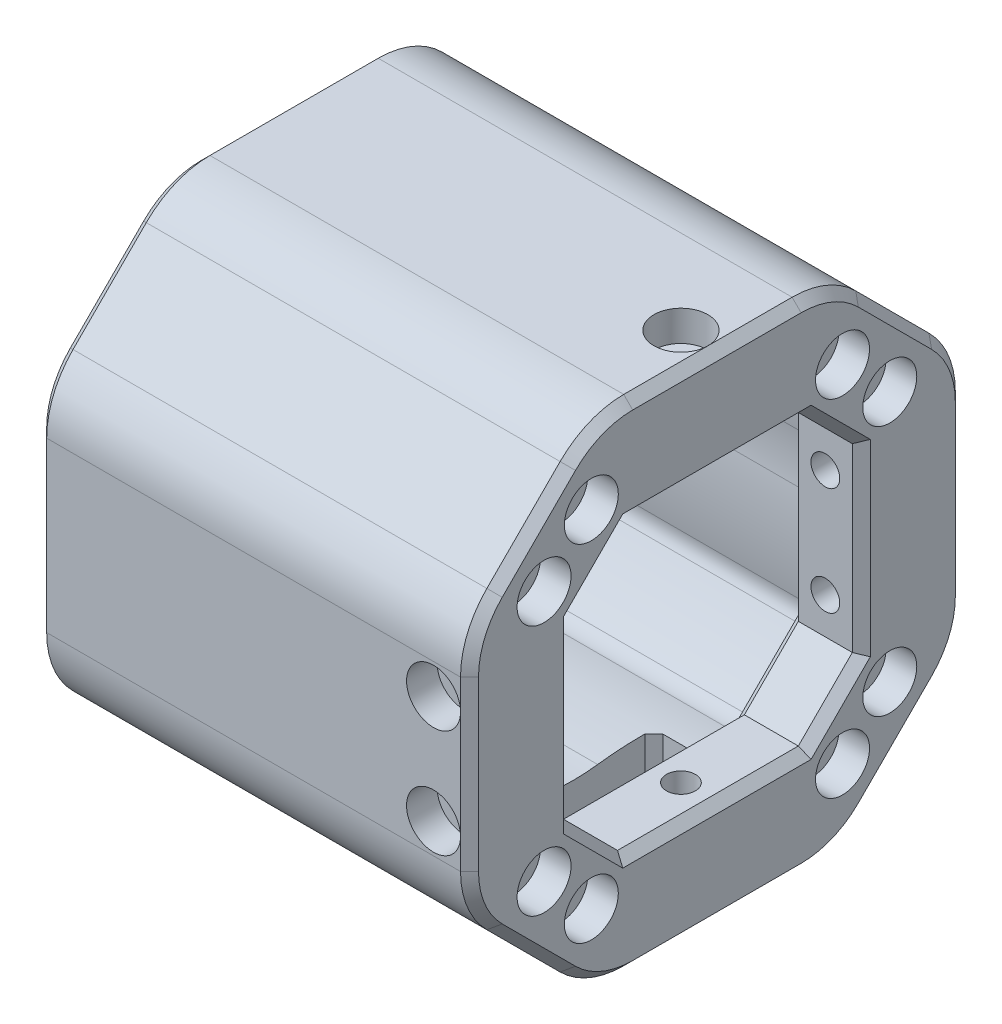
from build123d import *

# Parameters (mm, degrees)
SKETCH_1_W                   = 55
SKETCH_1_H                   = 55
SKETCH_1_W_2                 = 32.1
SKETCH_1_H_2                 = 32.1
EXTRUDE_1_DEPTH              = 8
CHAMFER_1_SIZE               = 14
CHAMFER_2_SIZE               = 6
HOLE_WIZARD_M3_1_D           = 3.2
HOLE_WIZARD_M3_1_CBORE_D     = 6
HOLE_WIZARD_M3_1_CBORE_DEPTH = 3.4
HOLE_WIZARD_M3_2_D           = 3.2
HOLE_WIZARD_M3_2_DEPTH       = 11.45
HOLE_WIZARD_M3_2_CBORE_D     = 6
HOLE_WIZARD_M3_2_CBORE_DEPTH = 3.4
HOLE_WIZARD_M3_3_D           = 3.2
HOLE_WIZARD_M3_3_DEPTH       = 11.45
HOLE_WIZARD_M3_3_CBORE_D     = 6
HOLE_WIZARD_M3_3_CBORE_DEPTH = 3.4
HOLE_WIZARD_M3_4_D           = 3.2
HOLE_WIZARD_M3_4_CBORE_D     = 6
HOLE_WIZARD_M3_4_CBORE_DEPTH = 3.4
HOLE_WIZARD_M3_5_D           = 3.2
HOLE_WIZARD_M3_5_CBORE_D     = 6
HOLE_WIZARD_M3_5_CBORE_DEPTH = 3.4
FILLET_1_R                   = 10
CHAMFER_4_SIZE               = 1
EXTRUDE_2_DEPTH              = 40
CHAMFER_5_SIZE               = 1
SKETCH_18_W                  = 8
SKETCH_18_H                  = 18
CUT_EXTRUDE_1_DEPTH          = 40
CHAMFER_6_SIZE               = 1
CHAMFER_7_SIZE               = 1


# Some blends are built 0.0001 mm under size
with BuildPart() as part:
    # 草图1 → 凸台-拉伸1 (new body)
    with BuildSketch(Plane(origin=(0, 0, 0), x_dir=(0, 0, -1), z_dir=(1, 0, 0))):
        Rectangle(SKETCH_1_W, SKETCH_1_H)
        Rectangle(SKETCH_1_W_2, SKETCH_1_H_2, mode=Mode.SUBTRACT)
    extrude(amount=EXTRUDE_1_DEPTH)

    # 倒角1
    chamfer_1_edges = [part.edges().sort_by_distance(p)[0] for p in [
        (4, -27.5, -27.5),
        (4, -27.5, 27.5),
        (4, 27.5, 27.5),
        (4, 27.5, -27.5),
    ]]
    chamfer(chamfer_1_edges, length=CHAMFER_1_SIZE)

    # 倒角2
    chamfer_2_edges = [part.edges().sort_by_distance(p)[0] for p in [
        (4, -16.05, -16.05),
        (4, 16.05, -16.05),
        (4, 16.05, 16.05),
        (4, -16.05, 16.05),
    ]]
    chamfer(chamfer_2_edges, length=CHAMFER_2_SIZE)

    # M3 六角圆柱头螺钉的柱形沉头孔1 (through all)
    with Locations(Plane(origin=(8, 0, 0), x_dir=(0, 0, -1), z_dir=(1, 0, 0))):
        with Locations((-13.959899742, 19.214153616), (13.959899742, 19.214153616), (19.214153616, -13.959899742), (-13.959899742, -19.214153616), (-19.214153616, 13.959899742), (19.214153616, 13.959899742), (13.959899742, -19.214153616), (-19.214153616, -13.959899742)):
            CounterBoreHole(HOLE_WIZARD_M3_1_D / 2, HOLE_WIZARD_M3_1_CBORE_D / 2, HOLE_WIZARD_M3_1_CBORE_DEPTH)

    # M3 六角圆柱头螺钉的柱形沉头孔2
    with Locations(Plane(origin=(0, 27.5, 0), x_dir=(1, 0, 0), z_dir=(0, 1, 0))):
        with Locations((4, 0)):
            CounterBoreHole(HOLE_WIZARD_M3_2_D / 2, HOLE_WIZARD_M3_2_CBORE_D / 2, HOLE_WIZARD_M3_2_CBORE_DEPTH, depth=HOLE_WIZARD_M3_2_DEPTH)

    # M3 六角圆柱头螺钉的柱形沉头孔3
    with Locations(Plane(origin=(0, 0, -27.5), x_dir=(-1, 0, 0), z_dir=(0, 0, -1))):
        with Locations((-4, 6), (-4, -6)):
            CounterBoreHole(HOLE_WIZARD_M3_3_D / 2, HOLE_WIZARD_M3_3_CBORE_D / 2, HOLE_WIZARD_M3_3_CBORE_DEPTH, depth=HOLE_WIZARD_M3_3_DEPTH)

    # M3 六角圆柱头螺钉的柱形沉头孔4 (through all)
    with Locations(Plane.XY.offset(27.5)):
        with Locations((4, -6), (4, 6)):
            CounterBoreHole(HOLE_WIZARD_M3_4_D / 2, HOLE_WIZARD_M3_4_CBORE_D / 2, HOLE_WIZARD_M3_4_CBORE_DEPTH)

    # M3 六角圆柱头螺钉的柱形沉头孔5 (through all)
    with Locations(Plane.XZ.offset(27.5)):
        with Locations((4, 0)):
            CounterBoreHole(HOLE_WIZARD_M3_5_D / 2, HOLE_WIZARD_M3_5_CBORE_D / 2, HOLE_WIZARD_M3_5_CBORE_DEPTH)

    # 圆角1
    fillet_1_edges = [part.edges().sort_by_distance(p)[0] for p in [
        (4, -27.5, -13.5),
        (4, -27.5, 13.5),
        (4, 13.5, 27.5),
        (4, -13.5, 27.5),
        (4, 13.5, -27.5),
        (4, -13.5, -27.5),
        (4, 27.5, 13.5),
        (4, 27.5, -13.5),
    ]]
    fillet(fillet_1_edges, radius=FILLET_1_R)

    # 倒角4
    chamfer_4_edges = [part.edges().sort_by_distance(p)[0] for p in [
        (8, 27.5, 0),
        (8, 0, 27.5),
        (8, -20.5, 20.5),
        (8, -27.5, 0),
        (8, -20.5, -20.5),
        (8, 0, -27.5),
        (8, 20.5, -20.5),
        (8, 20.5, 20.5),
        (8, -13.1846987, 26.738795325),
        (8, -26.738795325, 13.1846987),
        (8, -26.738795325, -13.1846987),
        (8, -13.1846987, -26.738795325),
        (8, 13.1846987, -26.738795325),
        (8, 26.738795325, -13.1846987),
        (8, 13.1846987, 26.738795325),
        (8, 26.738795325, 13.1846987),
        (8, 0, 16.05),
        (8, -16.05, 0),
        (8, 0, -16.05),
        (8, 16.05, 0),
        (8, -13.05, 13.05),
        (8, -13.05, -13.05),
        (8, 13.05, -13.05),
        (8, 13.05, 13.05),
    ]]
    chamfer(chamfer_4_edges, length=CHAMFER_4_SIZE - 0.0001)  # a hair under: the kernel refuses the full size

    # 草图16 → 凸台-拉伸2 (add)
    with BuildSketch(Plane.ZY):
        with BuildLine():
            Line((27.5, -9.357864376), (27.5, 9.357864376))
            ThreePointArc((27.5, 9.357864376), (26.738795325, 13.1846987), (24.571067812, 16.428932188))
            Line((24.571067812, 16.428932188), (16.428932188, 24.571067812))
            ThreePointArc((16.428932188, 24.571067812), (13.1846987, 26.738795325), (9.357864376, 27.5))
            Line((9.357864376, 27.5), (-9.357864376, 27.5))
            ThreePointArc((-9.357864376, 27.5), (-13.1846987, 26.738795325), (-16.428932188, 24.571067812))
            Line((-16.428932188, 24.571067812), (-24.571067812, 16.428932188))
            ThreePointArc((-24.571067812, 16.428932188), (-26.738795325, 13.1846987), (-27.5, 9.357864376))
            Line((-27.5, 9.357864376), (-27.5, -9.357864376))
            ThreePointArc((-27.5, -9.357864376), (-26.738795325, -13.1846987), (-24.571067812, -16.428932188))
            Line((-24.571067812, -16.428932188), (-16.428932188, -24.571067812))
            ThreePointArc((-16.428932188, -24.571067812), (-13.1846987, -26.738795325), (-9.357864376, -27.5))
            Line((-9.357864376, -27.5), (9.357864376, -27.5))
            ThreePointArc((9.357864376, -27.5), (13.1846987, -26.738795325), (16.428932188, -24.571067812))
            Line((16.428932188, -24.571067812), (24.571067812, -16.428932188))
            ThreePointArc((24.571067812, -16.428932188), (26.738795325, -13.1846987), (27.5, -9.357864376))
        make_face()
        with BuildLine():
            ThreePointArc((2.7470939, -21.676622779), (0, -21.85), (-2.7470939, -21.676622779))
            ThreePointArc((-2.7470939, -21.676622779), (-8.167703104, -21.362068054), (-13.580827481, -21.786371379))
            ThreePointArc((-13.580827481, -21.786371379), (-14.580451707, -21.73901307), (-15.488141398, -21.317597802))
            ThreePointArc((-15.488141398, -21.317597802), (-18.632263684, -18.632263684), (-21.317597802, -15.488141398))
            ThreePointArc((-21.317597802, -15.488141398), (-21.73901307, -14.580451707), (-21.786371379, -13.580827481))
            ThreePointArc((-21.786371379, -13.580827481), (-21.362068054, -8.167703104), (-21.676622779, -2.7470939))
            ThreePointArc((-21.676622779, -2.7470939), (-21.85, 0), (-21.676622779, 2.7470939))
            ThreePointArc((-21.676622779, 2.7470939), (-21.362068054, 8.167703104), (-21.786371379, 13.580827481))
            ThreePointArc((-21.786371379, 13.580827481), (-21.73901307, 14.580451707), (-21.317597802, 15.488141398))
            ThreePointArc((-21.317597802, 15.488141398), (-18.632263684, 18.632263684), (-15.488141398, 21.317597802))
            ThreePointArc((-15.488141398, 21.317597802), (-14.580451707, 21.73901307), (-13.580827481, 21.786371379))
            ThreePointArc((-13.580827481, 21.786371379), (-8.167703104, 21.362068054), (-2.7470939, 21.676622779))
            ThreePointArc((-2.7470939, 21.676622779), (0, 21.85), (2.7470939, 21.676622779))
            ThreePointArc((2.7470939, 21.676622779), (8.167703104, 21.362068054), (13.580827481, 21.786371379))
            ThreePointArc((13.580827481, 21.786371379), (14.580451707, 21.73901307), (15.488141398, 21.317597802))
            ThreePointArc((15.488141398, 21.317597802), (18.632263684, 18.632263684), (21.317597802, 15.488141398))
            ThreePointArc((21.317597802, 15.488141398), (21.73901307, 14.580451707), (21.786371379, 13.580827481))
            ThreePointArc((21.786371379, 13.580827481), (21.362068054, 8.167703104), (21.676622779, 2.7470939))
            ThreePointArc((21.676622779, 2.7470939), (21.85, 0), (21.676622779, -2.7470939))
            ThreePointArc((21.676622779, -2.7470939), (21.362068054, -8.167703104), (21.786371379, -13.580827481))
            ThreePointArc((21.786371379, -13.580827481), (21.73901307, -14.580451707), (21.317597802, -15.488141398))
            ThreePointArc((21.317597802, -15.488141398), (18.632263684, -18.632263684), (15.488141398, -21.317597802))
            ThreePointArc((15.488141398, -21.317597802), (14.580451707, -21.73901307), (13.580827481, -21.786371379))
            ThreePointArc((13.580827481, -21.786371379), (8.167703104, -21.362068054), (2.7470939, -21.676622779))
        make_face(mode=Mode.SUBTRACT)
    extrude(amount=EXTRUDE_2_DEPTH)

    # 倒角5
    chamfer_5_edges = [part.edges().sort_by_distance(p)[0] for p in [
        (-40, -21.73901307, -14.580451707),
        (-40, -18.632263684, -18.632263684),
        (-40, -8.167703104, -21.362068054),
        (-40, 0, -21.85),
        (-40, 14.580451707, -21.73901307),
        (-40, 21.362068054, -8.167703104),
        (-40, 21.85, 0),
        (-40, 21.73901307, 14.580451707),
        (-40, 18.632263684, 18.632263684),
        (-40, 8.167703104, 21.362068054),
        (-40, -14.580451707, 21.73901307),
        (-40, -21.362068054, 8.167703104),
        (-40, -21.85, 0),
        (-40, -21.362068054, -8.167703104),
        (-40, -14.580451707, -21.73901307),
        (-40, 8.167703104, -21.362068054),
        (-40, 18.632263684, -18.632263684),
        (-40, 21.73901307, -14.580451707),
        (-40, 21.362068054, 8.167703104),
        (-40, 14.580451707, 21.73901307),
        (-40, 0, 21.85),
        (-40, -8.167703104, 21.362068054),
        (-40, -18.632263684, 18.632263684),
        (-40, -21.73901307, 14.580451707),
        (-40, 0, 27.5),
        (-40, 13.1846987, 26.738795325),
        (-40, 20.5, 20.5),
        (-40, 26.738795325, 13.1846987),
        (-40, 27.5, 0),
        (-40, 26.738795325, -13.1846987),
        (-40, 20.5, -20.5),
        (-40, 13.1846987, -26.738795325),
        (-40, 0, -27.5),
        (-40, -13.1846987, -26.738795325),
        (-40, -20.5, -20.5),
        (-40, -26.738795325, -13.1846987),
        (-40, -27.5, 0),
        (-40, -26.738795325, 13.1846987),
        (-40, -20.5, 20.5),
        (-40, -13.1846987, 26.738795325),
        (0, 0, 16.05),
        (0, -16.05, 0),
        (0, 0, -16.05),
        (0, 16.05, 0),
        (0, -13.05, 13.05),
        (0, -13.05, -13.05),
        (0, 13.05, -13.05),
        (0, 13.05, 13.05),
    ]]
    chamfer(chamfer_5_edges, length=CHAMFER_5_SIZE)

    # 草图18 → 切除-拉伸1 (cut)
    with BuildSketch(Plane.XZ.offset(27.5)):
        with Locations((-4, 0)):
            Rectangle(SKETCH_18_W, SKETCH_18_H)
    extrude(amount=-CUT_EXTRUDE_1_DEPTH, mode=Mode.SUBTRACT)

    # 倒角6
    chamfer_6_edges = [part.edges().sort_by_distance(p)[0] for p in [
        (0, -24.439592119, -9),
        (-8, -24.439592119, -9),
        (0, -24.439592119, 9),
        (-8, -24.439592119, 9),
    ]]
    chamfer(chamfer_6_edges, length=CHAMFER_6_SIZE)

    # 倒角7
    # the kernel refuses this chamfer: 1 mm, written as the material it takes off along each edge
    with BuildSketch(Plane(origin=(1.571682988, -27.5, -9), x_dir=(0, -0.027495876610585647, -0.9996219169112968), z_dir=(-1, 0, 0))) as chamfer_7_piece_1_section:
        Polygon((CHAMFER_7_SIZE * 0.999621916911, -CHAMFER_7_SIZE * 0.0274958766106), (-CHAMFER_7_SIZE * 0.0274958766106, -CHAMFER_7_SIZE * 0.999621916911), (0, 0), align=None)
    chamfer_7_piece_1 = extrude(amount=11.143365976, mode=Mode.PRIVATE)
    chamfer_7_piece_1 = split(chamfer_7_piece_1, bisect_by=Plane(origin=(-5.34699413, -27.157492475, -10.65300587), z_dir=(0.7071067811865476, 0, 0.7071067811865476)), keep=Keep.TOP, mode=Mode.PRIVATE)
    chamfer_7_piece_1 = split(chamfer_7_piece_1, bisect_by=Plane(origin=(-2.65300587, -27.157492475, -10.65300587), z_dir=(-0.7071067811865476, 0, 0.7071067811865476)), keep=Keep.TOP, mode=Mode.PRIVATE)
    add(chamfer_7_piece_1, mode=Mode.SUBTRACT)
    with BuildSketch(Plane(origin=(-8, -27.5, -10.571682988), x_dir=(-0.9996219169112968, -0.027495876610585647, 0), z_dir=(0, 0, 1))) as chamfer_7_piece_2_section:
        Polygon((CHAMFER_7_SIZE * 0.999621916911, -CHAMFER_7_SIZE * 0.0274958766106), (-CHAMFER_7_SIZE * 0.0274958766106, -CHAMFER_7_SIZE * 0.999621916911), (0, 0), align=None)
    chamfer_7_piece_2 = extrude(amount=21.143365976, mode=Mode.PRIVATE)
    chamfer_7_piece_2 = split(chamfer_7_piece_2, bisect_by=Plane(origin=(-12.160757254, -27.165780321, -3.839242746), z_dir=(0.7071067811865476, 0, 0.7071067811865476)), keep=Keep.TOP, mode=Mode.PRIVATE)
    chamfer_7_piece_2 = split(chamfer_7_piece_2, bisect_by=Plane(origin=(-12.160757254, -27.165780321, 3.839242746), z_dir=(0.7071067811865476, 0, -0.7071067811865476)), keep=Keep.TOP, mode=Mode.PRIVATE)
    add(chamfer_7_piece_2, mode=Mode.SUBTRACT)
    with BuildSketch(Plane(origin=(0, -27.5, 10.571682988), x_dir=(0.9996219169112968, -0.02749587661058563, 0), z_dir=(0, 0, -1))) as chamfer_7_piece_3_section:
        Polygon((CHAMFER_7_SIZE * 0.999621916911, -CHAMFER_7_SIZE * 0.0274958766106), (-CHAMFER_7_SIZE * 0.0274958766106, -CHAMFER_7_SIZE * 0.999621916911), (0, 0), align=None)
    chamfer_7_piece_3 = extrude(amount=21.143365976, mode=Mode.PRIVATE)
    chamfer_7_piece_3 = split(chamfer_7_piece_3, bisect_by=Plane(origin=(4.160757254, -27.165780321, -3.839242746), z_dir=(-0.7071067811865476, 0, 0.7071067811865476)), keep=Keep.TOP, mode=Mode.PRIVATE)
    chamfer_7_piece_3 = split(chamfer_7_piece_3, bisect_by=Plane(origin=(4.160757254, -27.165780321, 3.839242746), z_dir=(-0.7071067811865476, 0, -0.7071067811865476)), keep=Keep.TOP, mode=Mode.PRIVATE)
    add(chamfer_7_piece_3, mode=Mode.SUBTRACT)
    with BuildSketch(Plane(origin=(-9.571682988, -27.5, 9), x_dir=(0, -0.027495876610585647, 0.9996219169112968), z_dir=(1, 0, 0))) as chamfer_7_piece_4_section:
        Polygon((CHAMFER_7_SIZE * 0.999621916911, -CHAMFER_7_SIZE * 0.0274958766106), (-CHAMFER_7_SIZE * 0.0274958766106, -CHAMFER_7_SIZE * 0.999621916911), (0, 0), align=None)
    chamfer_7_piece_4 = extrude(amount=11.143365976, mode=Mode.PRIVATE)
    chamfer_7_piece_4 = split(chamfer_7_piece_4, bisect_by=Plane(origin=(-5.34699413, -27.157492475, 10.65300587), z_dir=(0.7071067811865476, 0, -0.7071067811865476)), keep=Keep.TOP, mode=Mode.PRIVATE)
    chamfer_7_piece_4 = split(chamfer_7_piece_4, bisect_by=Plane(origin=(-2.65300587, -27.157492475, 10.65300587), z_dir=(-0.7071067811865476, 0, -0.7071067811865476)), keep=Keep.TOP, mode=Mode.PRIVATE)
    add(chamfer_7_piece_4, mode=Mode.SUBTRACT)
    with BuildSketch(Plane(origin=(-9.81845448, -27.5, -6.18154552), x_dir=(-0.7068394360706736, -0.027495876610585664, -0.7068394360706736), z_dir=(0.7071067811865476, 0, -0.7071067811865476))) as chamfer_7_piece_5_section:
        Polygon((CHAMFER_7_SIZE * 0.999621916911, CHAMFER_7_SIZE * 0.0274958766106), (-CHAMFER_7_SIZE * 0.0274958766106, CHAMFER_7_SIZE * 0.999621916911), (0, 0), align=None)
    chamfer_7_piece_5 = extrude(amount=6.557579538, mode=Mode.PRIVATE)
    chamfer_7_piece_5 = split(chamfer_7_piece_5, bisect_by=Plane(origin=(-8, -27.091058446, -8.62872483), z_dir=(1, 0, 0)), keep=Keep.TOP, mode=Mode.PRIVATE)
    chamfer_7_piece_5 = split(chamfer_7_piece_5, bisect_by=Plane(origin=(-7.62872483, -27.091058446, -9), z_dir=(0, 0, 1)), keep=Keep.TOP, mode=Mode.PRIVATE)
    add(chamfer_7_piece_5, mode=Mode.SUBTRACT)
    with BuildSketch(Plane(origin=(-9.81845448, -27.5, -6.18154552), x_dir=(-0.7068394360706736, -0.027495876610585664, -0.7068394360706736), z_dir=(0.7071067811865476, 0, -0.7071067811865476))) as chamfer_7_piece_6_section:
        Polygon((CHAMFER_7_SIZE * 0.999621916911, CHAMFER_7_SIZE * 0.0274958766106), (-CHAMFER_7_SIZE * 0.0274958766106, CHAMFER_7_SIZE * 0.999621916911), (0, 0), align=None)
    chamfer_7_piece_6 = extrude(amount=6.557579538, mode=Mode.PRIVATE)
    chamfer_7_piece_6 = split(chamfer_7_piece_6, bisect_by=Plane(origin=(-8, -27.456856747, -9.119731246), z_dir=(-1, 0, 0)), keep=Keep.TOP, mode=Mode.PRIVATE)
    chamfer_7_piece_6 = split(chamfer_7_piece_6, bisect_by=Plane(origin=(-8.119731246, -27.456856747, -9), z_dir=(0, 0, -1)), keep=Keep.TOP, mode=Mode.PRIVATE)
    add(chamfer_7_piece_6, mode=Mode.SUBTRACT)
    with BuildSketch(Plane(origin=(-2.81845448, -27.5, -10.81845448), x_dir=(0.7068394360706736, -0.027495876610585664, -0.7068394360706736), z_dir=(0.7071067811865476, 0, 0.7071067811865476))) as chamfer_7_piece_7_section:
        Polygon((CHAMFER_7_SIZE * 0.999621916911, CHAMFER_7_SIZE * 0.0274958766106), (-CHAMFER_7_SIZE * 0.0274958766106, CHAMFER_7_SIZE * 0.999621916911), (0, 0), align=None)
    chamfer_7_piece_7 = extrude(amount=6.557579538, mode=Mode.PRIVATE)
    chamfer_7_piece_7 = split(chamfer_7_piece_7, bisect_by=Plane(origin=(-0.37127517, -27.091058446, -9), z_dir=(0, 0, 1)), keep=Keep.TOP, mode=Mode.PRIVATE)
    chamfer_7_piece_7 = split(chamfer_7_piece_7, bisect_by=Plane(origin=(0, -27.091058446, -8.62872483), z_dir=(-1, 0, 0)), keep=Keep.TOP, mode=Mode.PRIVATE)
    add(chamfer_7_piece_7, mode=Mode.SUBTRACT)
    with BuildSketch(Plane(origin=(-2.81845448, -27.5, -10.81845448), x_dir=(0.7068394360706736, -0.027495876610585664, -0.7068394360706736), z_dir=(0.7071067811865476, 0, 0.7071067811865476))) as chamfer_7_piece_8_section:
        Polygon((CHAMFER_7_SIZE * 0.999621916911, CHAMFER_7_SIZE * 0.0274958766106), (-CHAMFER_7_SIZE * 0.0274958766106, CHAMFER_7_SIZE * 0.999621916911), (0, 0), align=None)
    chamfer_7_piece_8 = extrude(amount=6.557579538, mode=Mode.PRIVATE)
    chamfer_7_piece_8 = split(chamfer_7_piece_8, bisect_by=Plane(origin=(0.119731246, -27.456856747, -9), z_dir=(0, 0, -1)), keep=Keep.TOP, mode=Mode.PRIVATE)
    chamfer_7_piece_8 = split(chamfer_7_piece_8, bisect_by=Plane(origin=(0, -27.456856747, -9.119731246), z_dir=(1, 0, 0)), keep=Keep.TOP, mode=Mode.PRIVATE)
    add(chamfer_7_piece_8, mode=Mode.SUBTRACT)
    with BuildSketch(Plane(origin=(-5.18154552, -27.5, 10.81845448), x_dir=(-0.7068394360706735, -0.027495876610585612, 0.7068394360706735), z_dir=(-0.7071067811865476, 0, -0.7071067811865476))) as chamfer_7_piece_9_section:
        Polygon((CHAMFER_7_SIZE * 0.999621916911, CHAMFER_7_SIZE * 0.0274958766106), (-CHAMFER_7_SIZE * 0.0274958766106, CHAMFER_7_SIZE * 0.999621916911), (0, 0), align=None)
    chamfer_7_piece_9 = extrude(amount=6.557579538, mode=Mode.PRIVATE)
    chamfer_7_piece_9 = split(chamfer_7_piece_9, bisect_by=Plane(origin=(-8, -27.091058446, 8.62872483), z_dir=(1, 0, 0)), keep=Keep.TOP, mode=Mode.PRIVATE)
    chamfer_7_piece_9 = split(chamfer_7_piece_9, bisect_by=Plane(origin=(-7.62872483, -27.091058446, 9), z_dir=(0, 0, -1)), keep=Keep.TOP, mode=Mode.PRIVATE)
    add(chamfer_7_piece_9, mode=Mode.SUBTRACT)
    with BuildSketch(Plane(origin=(-5.18154552, -27.5, 10.81845448), x_dir=(-0.7068394360706735, -0.027495876610585612, 0.7068394360706735), z_dir=(-0.7071067811865476, 0, -0.7071067811865476))) as chamfer_7_piece_10_section:
        Polygon((CHAMFER_7_SIZE * 0.999621916911, CHAMFER_7_SIZE * 0.0274958766106), (-CHAMFER_7_SIZE * 0.0274958766106, CHAMFER_7_SIZE * 0.999621916911), (0, 0), align=None)
    chamfer_7_piece_10 = extrude(amount=6.557579538, mode=Mode.PRIVATE)
    chamfer_7_piece_10 = split(chamfer_7_piece_10, bisect_by=Plane(origin=(-8, -27.456856747, 9.119731246), z_dir=(-1, 0, 0)), keep=Keep.TOP, mode=Mode.PRIVATE)
    chamfer_7_piece_10 = split(chamfer_7_piece_10, bisect_by=Plane(origin=(-8.119731246, -27.456856747, 9), z_dir=(0, 0, 1)), keep=Keep.TOP, mode=Mode.PRIVATE)
    add(chamfer_7_piece_10, mode=Mode.SUBTRACT)
    with BuildSketch(Plane(origin=(-2.81845448, -27.5, 10.81845448), x_dir=(0.7068394360706735, -0.02749587661058563, 0.7068394360706735), z_dir=(0.7071067811865476, 0, -0.7071067811865476))) as chamfer_7_piece_11_section:
        Polygon((CHAMFER_7_SIZE * 0.999621916911, -CHAMFER_7_SIZE * 0.0274958766106), (-CHAMFER_7_SIZE * 0.0274958766106, -CHAMFER_7_SIZE * 0.999621916911), (0, 0), align=None)
    chamfer_7_piece_11 = extrude(amount=6.557579538, mode=Mode.PRIVATE)
    chamfer_7_piece_11 = split(chamfer_7_piece_11, bisect_by=Plane(origin=(-0.37127517, -27.091058446, 9), z_dir=(0, 0, -1)), keep=Keep.TOP, mode=Mode.PRIVATE)
    chamfer_7_piece_11 = split(chamfer_7_piece_11, bisect_by=Plane(origin=(0, -27.091058446, 8.62872483), z_dir=(-1, 0, 0)), keep=Keep.TOP, mode=Mode.PRIVATE)
    add(chamfer_7_piece_11, mode=Mode.SUBTRACT)
    with BuildSketch(Plane(origin=(-2.81845448, -27.5, 10.81845448), x_dir=(0.7068394360706735, -0.02749587661058563, 0.7068394360706735), z_dir=(0.7071067811865476, 0, -0.7071067811865476))) as chamfer_7_piece_12_section:
        Polygon((CHAMFER_7_SIZE * 0.999621916911, -CHAMFER_7_SIZE * 0.0274958766106), (-CHAMFER_7_SIZE * 0.0274958766106, -CHAMFER_7_SIZE * 0.999621916911), (0, 0), align=None)
    chamfer_7_piece_12 = extrude(amount=6.557579538, mode=Mode.PRIVATE)
    chamfer_7_piece_12 = split(chamfer_7_piece_12, bisect_by=Plane(origin=(0.119731246, -27.456856747, 9), z_dir=(0, 0, 1)), keep=Keep.TOP, mode=Mode.PRIVATE)
    chamfer_7_piece_12 = split(chamfer_7_piece_12, bisect_by=Plane(origin=(0, -27.456856747, 9.119731246), z_dir=(1, 0, 0)), keep=Keep.TOP, mode=Mode.PRIVATE)
    add(chamfer_7_piece_12, mode=Mode.SUBTRACT)
    with BuildSketch(Plane(origin=(-2.81845448, -27.5, -10.81845448), x_dir=(0.7068394360706736, -0.027495876610585664, -0.7068394360706736), z_dir=(0.7071067811865476, 0, 0.7071067811865476))) as chamfer_7_piece_13a_section:
        Polygon((CHAMFER_7_SIZE * 0.999621916911, CHAMFER_7_SIZE * 0.0274958766106), (-CHAMFER_7_SIZE * 0.0274958766106, CHAMFER_7_SIZE * 0.999621916911), (0, 0), align=None)
    chamfer_7_piece_13a = extrude(amount=6.557579538, mode=Mode.PRIVATE)
    chamfer_7_piece_13a = split(chamfer_7_piece_13a, bisect_by=Plane(origin=(-1.549060796, -27.179773879, -9), z_dir=(0, 0, -1)), keep=Keep.TOP, mode=Mode.PRIVATE)
    chamfer_7_piece_13a = split(chamfer_7_piece_13a, bisect_by=Plane(origin=(0, -27.179773879, -10.040654169), z_dir=(-1, 0, 0)), keep=Keep.TOP, mode=Mode.PRIVATE)
    with BuildSketch(Plane(origin=(1.571682988, -27.5, -9), x_dir=(0, -0.027495876610585647, -0.9996219169112968), z_dir=(-1, 0, 0))) as chamfer_7_piece_13b_section:
        Polygon((CHAMFER_7_SIZE * 0.999621916911, -CHAMFER_7_SIZE * 0.0274958766106), (-CHAMFER_7_SIZE * 0.0274958766106, -CHAMFER_7_SIZE * 0.999621916911), (0, 0), align=None)
    chamfer_7_piece_13b = extrude(amount=11.143365976, mode=Mode.PRIVATE)
    chamfer_7_piece_13b = split(chamfer_7_piece_13b, bisect_by=Plane(origin=(-0.620839187, -27.181906875, -8.620839187), z_dir=(0.7071067811865476, 0, -0.7071067811865476)), keep=Keep.TOP, mode=Mode.PRIVATE)
    chamfer_7_piece_13 = chamfer_7_piece_13a & chamfer_7_piece_13b
    add(chamfer_7_piece_13, mode=Mode.SUBTRACT)
    with BuildSketch(Plane(origin=(1.571682988, -27.5, -9), x_dir=(0, -0.027495876610585647, -0.9996219169112968), z_dir=(-1, 0, 0))) as chamfer_7_piece_14a_section:
        Polygon((CHAMFER_7_SIZE * 0.999621916911, -CHAMFER_7_SIZE * 0.0274958766106), (-CHAMFER_7_SIZE * 0.0274958766106, -CHAMFER_7_SIZE * 0.999621916911), (0, 0), align=None)
    chamfer_7_piece_14a = extrude(amount=11.143365976, mode=Mode.PRIVATE)
    chamfer_7_piece_14a = split(chamfer_7_piece_14a, bisect_by=Plane(origin=(-7.379160813, -27.181906875, -8.620839187), z_dir=(-0.7071067811865476, 0, -0.7071067811865476)), keep=Keep.TOP, mode=Mode.PRIVATE)
    with BuildSketch(Plane(origin=(-9.81845448, -27.5, -6.18154552), x_dir=(-0.7068394360706736, -0.027495876610585664, -0.7068394360706736), z_dir=(0.7071067811865476, 0, -0.7071067811865476))) as chamfer_7_piece_14b_section:
        Polygon((CHAMFER_7_SIZE * 0.999621916911, CHAMFER_7_SIZE * 0.0274958766106), (-CHAMFER_7_SIZE * 0.0274958766106, CHAMFER_7_SIZE * 0.999621916911), (0, 0), align=None)
    chamfer_7_piece_14b = extrude(amount=6.557579538, mode=Mode.PRIVATE)
    chamfer_7_piece_14b = split(chamfer_7_piece_14b, bisect_by=Plane(origin=(-8, -27.179773879, -10.040654169), z_dir=(1, 0, 0)), keep=Keep.TOP, mode=Mode.PRIVATE)
    chamfer_7_piece_14b = split(chamfer_7_piece_14b, bisect_by=Plane(origin=(-6.450939204, -27.179773879, -9), z_dir=(0, 0, -1)), keep=Keep.TOP, mode=Mode.PRIVATE)
    chamfer_7_piece_14 = chamfer_7_piece_14a & chamfer_7_piece_14b
    add(chamfer_7_piece_14, mode=Mode.SUBTRACT)
    with BuildSketch(Plane(origin=(-9.81845448, -27.5, -6.18154552), x_dir=(-0.7068394360706736, -0.027495876610585664, -0.7068394360706736), z_dir=(0.7071067811865476, 0, -0.7071067811865476))) as chamfer_7_piece_15a_section:
        Polygon((CHAMFER_7_SIZE * 0.999621916911, CHAMFER_7_SIZE * 0.0274958766106), (-CHAMFER_7_SIZE * 0.0274958766106, CHAMFER_7_SIZE * 0.999621916911), (0, 0), align=None)
    chamfer_7_piece_15a = extrude(amount=6.557579538, mode=Mode.PRIVATE)
    chamfer_7_piece_15a = split(chamfer_7_piece_15a, bisect_by=Plane(origin=(-8, -27.179773879, -7.450939204), z_dir=(-1, 0, 0)), keep=Keep.TOP, mode=Mode.PRIVATE)
    chamfer_7_piece_15a = split(chamfer_7_piece_15a, bisect_by=Plane(origin=(-9.040654169, -27.179773879, -9), z_dir=(0, 0, 1)), keep=Keep.TOP, mode=Mode.PRIVATE)
    with BuildSketch(Plane(origin=(-8, -27.5, -10.571682988), x_dir=(-0.9996219169112968, -0.027495876610585647, 0), z_dir=(0, 0, 1))) as chamfer_7_piece_15b_section:
        Polygon((CHAMFER_7_SIZE * 0.999621916911, -CHAMFER_7_SIZE * 0.0274958766106), (-CHAMFER_7_SIZE * 0.0274958766106, -CHAMFER_7_SIZE * 0.999621916911), (0, 0), align=None)
    chamfer_7_piece_15b = extrude(amount=21.143365976, mode=Mode.PRIVATE)
    chamfer_7_piece_15b = split(chamfer_7_piece_15b, bisect_by=Plane(origin=(-7.620839187, -27.181906875, -8.379160813), z_dir=(-0.7071067811865476, 0, -0.7071067811865476)), keep=Keep.TOP, mode=Mode.PRIVATE)
    chamfer_7_piece_15 = chamfer_7_piece_15a & chamfer_7_piece_15b
    add(chamfer_7_piece_15, mode=Mode.SUBTRACT)
    with BuildSketch(Plane(origin=(-5.18154552, -27.5, 10.81845448), x_dir=(-0.7068394360706735, -0.027495876610585612, 0.7068394360706735), z_dir=(-0.7071067811865476, 0, -0.7071067811865476))) as chamfer_7_piece_16a_section:
        Polygon((CHAMFER_7_SIZE * 0.999621916911, CHAMFER_7_SIZE * 0.0274958766106), (-CHAMFER_7_SIZE * 0.0274958766106, CHAMFER_7_SIZE * 0.999621916911), (0, 0), align=None)
    chamfer_7_piece_16a = extrude(amount=6.557579538, mode=Mode.PRIVATE)
    chamfer_7_piece_16a = split(chamfer_7_piece_16a, bisect_by=Plane(origin=(-8, -27.179773879, 7.450939204), z_dir=(-1, 0, 0)), keep=Keep.TOP, mode=Mode.PRIVATE)
    chamfer_7_piece_16a = split(chamfer_7_piece_16a, bisect_by=Plane(origin=(-9.040654169, -27.179773879, 9), z_dir=(0, 0, -1)), keep=Keep.TOP, mode=Mode.PRIVATE)
    with BuildSketch(Plane(origin=(-8, -27.5, -10.571682988), x_dir=(-0.9996219169112968, -0.027495876610585647, 0), z_dir=(0, 0, 1))) as chamfer_7_piece_16b_section:
        Polygon((CHAMFER_7_SIZE * 0.999621916911, -CHAMFER_7_SIZE * 0.0274958766106), (-CHAMFER_7_SIZE * 0.0274958766106, -CHAMFER_7_SIZE * 0.999621916911), (0, 0), align=None)
    chamfer_7_piece_16b = extrude(amount=21.143365976, mode=Mode.PRIVATE)
    chamfer_7_piece_16b = split(chamfer_7_piece_16b, bisect_by=Plane(origin=(-7.620839187, -27.181906875, 8.379160813), z_dir=(-0.7071067811865476, 0, 0.7071067811865476)), keep=Keep.TOP, mode=Mode.PRIVATE)
    chamfer_7_piece_16 = chamfer_7_piece_16a & chamfer_7_piece_16b
    add(chamfer_7_piece_16, mode=Mode.SUBTRACT)
    with BuildSketch(Plane(origin=(0, -27.5, 10.571682988), x_dir=(0.9996219169112968, -0.02749587661058563, 0), z_dir=(0, 0, -1))) as chamfer_7_piece_17a_section:
        Polygon((CHAMFER_7_SIZE * 0.999621916911, -CHAMFER_7_SIZE * 0.0274958766106), (-CHAMFER_7_SIZE * 0.0274958766106, -CHAMFER_7_SIZE * 0.999621916911), (0, 0), align=None)
    chamfer_7_piece_17a = extrude(amount=21.143365976, mode=Mode.PRIVATE)
    chamfer_7_piece_17a = split(chamfer_7_piece_17a, bisect_by=Plane(origin=(-0.379160813, -27.181906875, 8.379160813), z_dir=(0.7071067811865476, 0, 0.7071067811865476)), keep=Keep.TOP, mode=Mode.PRIVATE)
    with BuildSketch(Plane(origin=(-2.81845448, -27.5, 10.81845448), x_dir=(0.7068394360706735, -0.02749587661058563, 0.7068394360706735), z_dir=(0.7071067811865476, 0, -0.7071067811865476))) as chamfer_7_piece_17b_section:
        Polygon((CHAMFER_7_SIZE * 0.999621916911, -CHAMFER_7_SIZE * 0.0274958766106), (-CHAMFER_7_SIZE * 0.0274958766106, -CHAMFER_7_SIZE * 0.999621916911), (0, 0), align=None)
    chamfer_7_piece_17b = extrude(amount=6.557579538, mode=Mode.PRIVATE)
    chamfer_7_piece_17b = split(chamfer_7_piece_17b, bisect_by=Plane(origin=(1.040654169, -27.179773879, 9), z_dir=(0, 0, -1)), keep=Keep.TOP, mode=Mode.PRIVATE)
    chamfer_7_piece_17b = split(chamfer_7_piece_17b, bisect_by=Plane(origin=(0, -27.179773879, 7.450939204), z_dir=(1, 0, 0)), keep=Keep.TOP, mode=Mode.PRIVATE)
    chamfer_7_piece_17 = chamfer_7_piece_17a & chamfer_7_piece_17b
    add(chamfer_7_piece_17, mode=Mode.SUBTRACT)
    with BuildSketch(Plane(origin=(0, -27.5, 10.571682988), x_dir=(0.9996219169112968, -0.02749587661058563, 0), z_dir=(0, 0, -1))) as chamfer_7_piece_18a_section:
        Polygon((CHAMFER_7_SIZE * 0.999621916911, -CHAMFER_7_SIZE * 0.0274958766106), (-CHAMFER_7_SIZE * 0.0274958766106, -CHAMFER_7_SIZE * 0.999621916911), (0, 0), align=None)
    chamfer_7_piece_18a = extrude(amount=21.143365976, mode=Mode.PRIVATE)
    chamfer_7_piece_18a = split(chamfer_7_piece_18a, bisect_by=Plane(origin=(-0.379160813, -27.181906875, -8.379160813), z_dir=(0.7071067811865476, 0, -0.7071067811865476)), keep=Keep.TOP, mode=Mode.PRIVATE)
    with BuildSketch(Plane(origin=(-2.81845448, -27.5, -10.81845448), x_dir=(0.7068394360706736, -0.027495876610585664, -0.7068394360706736), z_dir=(0.7071067811865476, 0, 0.7071067811865476))) as chamfer_7_piece_18b_section:
        Polygon((CHAMFER_7_SIZE * 0.999621916911, CHAMFER_7_SIZE * 0.0274958766106), (-CHAMFER_7_SIZE * 0.0274958766106, CHAMFER_7_SIZE * 0.999621916911), (0, 0), align=None)
    chamfer_7_piece_18b = extrude(amount=6.557579538, mode=Mode.PRIVATE)
    chamfer_7_piece_18b = split(chamfer_7_piece_18b, bisect_by=Plane(origin=(1.040654169, -27.179773879, -9), z_dir=(0, 0, 1)), keep=Keep.TOP, mode=Mode.PRIVATE)
    chamfer_7_piece_18b = split(chamfer_7_piece_18b, bisect_by=Plane(origin=(0, -27.179773879, -7.450939204), z_dir=(1, 0, 0)), keep=Keep.TOP, mode=Mode.PRIVATE)
    chamfer_7_piece_18 = chamfer_7_piece_18a & chamfer_7_piece_18b
    add(chamfer_7_piece_18, mode=Mode.SUBTRACT)
    with BuildSketch(Plane(origin=(-9.571682988, -27.5, 9), x_dir=(0, -0.027495876610585647, 0.9996219169112968), z_dir=(1, 0, 0))) as chamfer_7_piece_19a_section:
        Polygon((CHAMFER_7_SIZE * 0.999621916911, -CHAMFER_7_SIZE * 0.0274958766106), (-CHAMFER_7_SIZE * 0.0274958766106, -CHAMFER_7_SIZE * 0.999621916911), (0, 0), align=None)
    chamfer_7_piece_19a = extrude(amount=11.143365976, mode=Mode.PRIVATE)
    chamfer_7_piece_19a = split(chamfer_7_piece_19a, bisect_by=Plane(origin=(-7.379160813, -27.181906875, 8.620839187), z_dir=(-0.7071067811865476, 0, 0.7071067811865476)), keep=Keep.TOP, mode=Mode.PRIVATE)
    with BuildSketch(Plane(origin=(-5.18154552, -27.5, 10.81845448), x_dir=(-0.7068394360706735, -0.027495876610585612, 0.7068394360706735), z_dir=(-0.7071067811865476, 0, -0.7071067811865476))) as chamfer_7_piece_19b_section:
        Polygon((CHAMFER_7_SIZE * 0.999621916911, CHAMFER_7_SIZE * 0.0274958766106), (-CHAMFER_7_SIZE * 0.0274958766106, CHAMFER_7_SIZE * 0.999621916911), (0, 0), align=None)
    chamfer_7_piece_19b = extrude(amount=6.557579538, mode=Mode.PRIVATE)
    chamfer_7_piece_19b = split(chamfer_7_piece_19b, bisect_by=Plane(origin=(-8, -27.179773879, 10.040654169), z_dir=(1, 0, 0)), keep=Keep.TOP, mode=Mode.PRIVATE)
    chamfer_7_piece_19b = split(chamfer_7_piece_19b, bisect_by=Plane(origin=(-6.450939204, -27.179773879, 9), z_dir=(0, 0, 1)), keep=Keep.TOP, mode=Mode.PRIVATE)
    chamfer_7_piece_19 = chamfer_7_piece_19a & chamfer_7_piece_19b
    add(chamfer_7_piece_19, mode=Mode.SUBTRACT)
    with BuildSketch(Plane(origin=(-2.81845448, -27.5, 10.81845448), x_dir=(0.7068394360706735, -0.02749587661058563, 0.7068394360706735), z_dir=(0.7071067811865476, 0, -0.7071067811865476))) as chamfer_7_piece_20a_section:
        Polygon((CHAMFER_7_SIZE * 0.999621916911, -CHAMFER_7_SIZE * 0.0274958766106), (-CHAMFER_7_SIZE * 0.0274958766106, -CHAMFER_7_SIZE * 0.999621916911), (0, 0), align=None)
    chamfer_7_piece_20a = extrude(amount=6.557579538, mode=Mode.PRIVATE)
    chamfer_7_piece_20a = split(chamfer_7_piece_20a, bisect_by=Plane(origin=(-1.549060796, -27.179773879, 9), z_dir=(0, 0, 1)), keep=Keep.TOP, mode=Mode.PRIVATE)
    chamfer_7_piece_20a = split(chamfer_7_piece_20a, bisect_by=Plane(origin=(0, -27.179773879, 10.040654169), z_dir=(-1, 0, 0)), keep=Keep.TOP, mode=Mode.PRIVATE)
    with BuildSketch(Plane(origin=(-9.571682988, -27.5, 9), x_dir=(0, -0.027495876610585647, 0.9996219169112968), z_dir=(1, 0, 0))) as chamfer_7_piece_20b_section:
        Polygon((CHAMFER_7_SIZE * 0.999621916911, -CHAMFER_7_SIZE * 0.0274958766106), (-CHAMFER_7_SIZE * 0.0274958766106, -CHAMFER_7_SIZE * 0.999621916911), (0, 0), align=None)
    chamfer_7_piece_20b = extrude(amount=11.143365976, mode=Mode.PRIVATE)
    chamfer_7_piece_20b = split(chamfer_7_piece_20b, bisect_by=Plane(origin=(-0.620839187, -27.181906875, 8.620839187), z_dir=(0.7071067811865476, 0, 0.7071067811865476)), keep=Keep.TOP, mode=Mode.PRIVATE)
    chamfer_7_piece_20 = chamfer_7_piece_20a & chamfer_7_piece_20b
    add(chamfer_7_piece_20, mode=Mode.SUBTRACT)


solid = part.part
